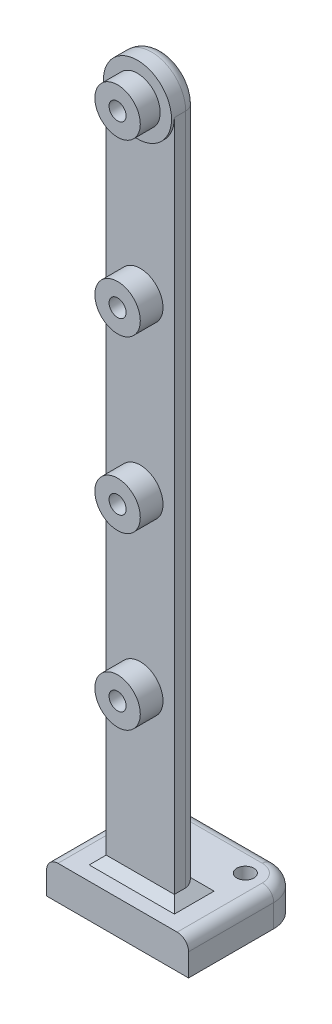
from build123d import *

# Parameters (mm, degrees)
SKETCH_1_R          = 4
SKETCH_1_R_2        = 1.5
EXTRUDE_1_DEPTH     = 4
SKETCH_1_4_R        = 4
SKETCH_1_4_R_2      = 1.5
EXTRUDE_3_DEPTH     = 8
SKETCH_1_5_R        = 4
EXTRUDE_4_DEPTH     = 4.5
SKETCH_2_W          = 25
SKETCH_2_H          = 6
EXTRUDE_5_DEPTH     = 20
CHAMFER_1_SIZE      = 1.5
FILLET_1_R          = 2
FILLET_2_R          = 5
FILLET_4_R          = 2
SKETCH_3_R          = 1.5
CUT_EXTRUDE_1_DEPTH = 20


with BuildPart() as part:
    # 草图1 → 凸台-拉伸1 (new body)
    with BuildSketch(Plane.XY):
        with BuildLine():
            ThreePointArc((6, 60), (0, 66), (-6, 60))
            Line((-6, 60), (-6, -60))
            ThreePointArc((-6, -60), (0, -66), (6, -60))
            Line((6, -60), (6, 60))
        make_face()
        with Locations((0, 30)):
            Circle(SKETCH_1_R, mode=Mode.SUBTRACT)
        Circle(SKETCH_1_R, mode=Mode.SUBTRACT)
        with Locations((0, -30)):
            Circle(SKETCH_1_R, mode=Mode.SUBTRACT)
        with Locations((0, 60)):
            Circle(SKETCH_1_R_2, mode=Mode.SUBTRACT)
    extrude(amount=EXTRUDE_1_DEPTH)

    # 草图1<4> → 凸台-拉伸3 (add)
    # profile 1 of 4: a face of its own
    with BuildSketch(Plane.XY):
        with Locations((0, 60)):
            Circle(SKETCH_1_4_R)
        with Locations((0, 60)):
            Circle(SKETCH_1_4_R_2, mode=Mode.SUBTRACT)
    # profile 2 of 4: a face of its own
    with BuildSketch(Plane.XY):
        with Locations((0, -30)):
            Circle(SKETCH_1_4_R)
        with Locations((0, -30)):
            Circle(SKETCH_1_4_R_2, mode=Mode.SUBTRACT)
    # profile 3 of 4: a face of its own
    with BuildSketch(Plane.XY):
        Circle(SKETCH_1_4_R)
        Circle(SKETCH_1_4_R_2, mode=Mode.SUBTRACT)
    # profile 4 of 4: a face of its own
    with BuildSketch(Plane.XY):
        with Locations((0, 30)):
            Circle(SKETCH_1_4_R)
        with Locations((0, 30)):
            Circle(SKETCH_1_4_R_2, mode=Mode.SUBTRACT)
    extrude(amount=EXTRUDE_3_DEPTH)

    # 草图1<5> → 凸台-拉伸4 (add)
    with BuildSketch(Plane.XY):
        with BuildLine():
            ThreePointArc((-6, 60), (0, 54), (6, 60))
            ThreePointArc((6, 60), (0, 66), (-6, 60))
        make_face()
        with Locations((0, 60)):
            Circle(SKETCH_1_5_R, mode=Mode.SUBTRACT)
    extrude(amount=EXTRUDE_4_DEPTH)

    # 草图2 → 凸台-拉伸5 (add)
    with BuildSketch(Plane.XY.offset(8)):
        with Locations((0, -63)):
            Rectangle(SKETCH_2_W, SKETCH_2_H)
    extrude(amount=-EXTRUDE_5_DEPTH)

    # 倒角1
    chamfer_1_edges = [part.edges().sort_by_distance(p)[0] for p in [
        (0, -60, 0),
        (-6, -60, 2),
        (0, -60, 4),
        (6, -60, 2),
    ]]
    chamfer(chamfer_1_edges, length=CHAMFER_1_SIZE)

    # 圆角1
    fillet_1_edges = [part.edges().sort_by_distance(p)[0] for p in [
        (-6, 0.75, 0),
        (0, 66, 0),
        (6, 0.75, 0),
    ]]
    fillet(fillet_1_edges, radius=FILLET_1_R)

    # 圆角2
    fillet_2_edges = [part.edges().sort_by_distance(p)[0] for p in [
        (-12.5, -63, -12),
        (12.5, -63, -12),
    ]]
    fillet(fillet_2_edges, radius=FILLET_2_R)

    # 圆角4
    fillet_4_edges = [part.edges().sort_by_distance(p)[0] for p in [
        (-11.035533906, -60, -10.535533906),
        (-12.5, -60, 0.5),
        (0, -60, -12),
        (11.035533906, -60, -10.535533906),
        (12.5, -60, 0.5),
    ]]
    fillet(fillet_4_edges, radius=FILLET_4_R)

    # 草图3 → 切除-拉伸1 (cut)
    with BuildSketch(Plane(origin=(0, -60, 0), x_dir=(1, 0, 0), z_dir=(0, 1, 0))):
        with Locations((-7.5, 7)):
            Circle(SKETCH_3_R)
        with Locations((7.5, 7)):
            Circle(SKETCH_3_R)
    extrude(amount=-CUT_EXTRUDE_1_DEPTH, mode=Mode.SUBTRACT)


solid = part.part
